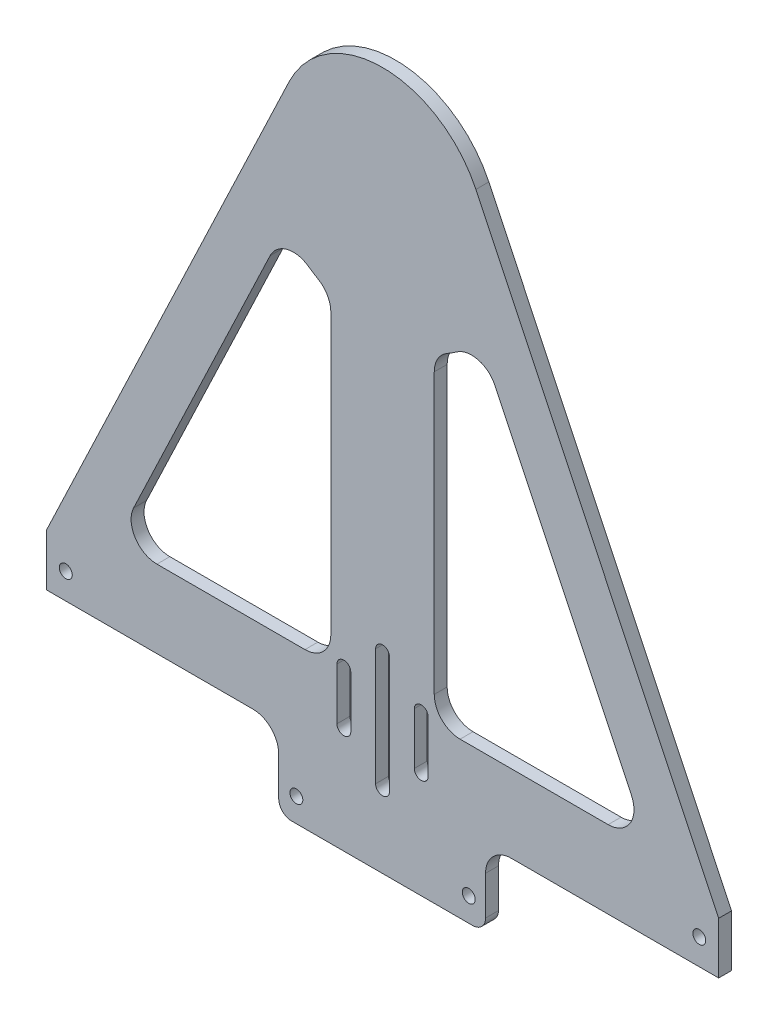
from build123d import *

# Parameters (mm, degrees)
SKETCH5_R           = 1.5875
BOSS_EXTRUDE2_DEPTH = 3.175


with BuildPart() as part:
    # Sketch5 → Boss-Extrude2 (new body)
    with BuildSketch(Plane.XY):
        with BuildLine():
            Line((-82.55, 58.42), (-82.55, 45.72))
            Line((-82.55, 45.72), (-31.848963051, 45.72))
            ThreePointArc((-31.848963051, 45.72), (-27.35883499, 43.860128061), (-25.498963051, 39.37))
            Line((-25.498963051, 39.37), (-25.498963051, 29.845))
            ThreePointArc((-25.498963051, 29.845), (-24.569027081, 27.59993597), (-22.323963051, 26.67))
            Line((-22.323963051, 26.67), (22.126036949, 26.67))
            ThreePointArc((22.126036949, 26.67), (24.37110098, 27.59993597), (25.301036949, 29.845))
            Line((25.301036949, 29.845), (25.301036949, 39.37))
            ThreePointArc((25.301036949, 39.37), (27.160908889, 43.860128061), (31.651036949, 45.72))
            Line((31.651036949, 45.72), (82.55, 45.72))
            Line((82.55, 45.72), (82.55, 58.42))
            Line((82.55, 58.42), (22.933465972, 183.638614313))
            ThreePointArc((22.933465972, 183.638614313), (0, 198.12), (-22.933465972, 183.638614313))
            Line((-22.933465972, 183.638614313), (-82.55, 58.42))
        make_face()
        with Locations((-77.7875, 52.07)):
            Circle(SKETCH5_R, mode=Mode.SUBTRACT)
        with Locations((77.7875, 52.07)):
            Circle(SKETCH5_R, mode=Mode.SUBTRACT)
        with Locations((-21.166666667, 32.503356634)):
            Circle(SKETCH5_R, mode=Mode.SUBTRACT)
        with Locations((21.166666667, 32.503356634)):
            Circle(SKETCH5_R, mode=Mode.SUBTRACT)
        with BuildLine():
            Line((-61.138040857, 73.849653578), (-27.615581335, 144.260253558))
            ThreePointArc((-27.615581335, 144.260253558), (-23.498279642, 147.671514779), (-18.235179035, 146.728833317))
            ThreePointArc((-18.235179035, 146.728833317), (-17.071685329, 145.950239821), (-15.875, 145.22369343))
            ThreePointArc((-15.875, 145.22369343), (-13.550738686, 142.899432116), (-12.7, 139.724432116))
            Line((-12.7, 139.724432116), (-12.7, 71.12))
            ThreePointArc((-12.7, 71.12), (-14.559871939, 66.629871939), (-19.05, 64.77))
            Line((-19.05, 64.77), (-55.404674364, 64.77))
            ThreePointArc((-55.404674364, 64.77), (-60.77383632, 67.729631305), (-61.138040857, 73.849653578))
        make_face(mode=Mode.SUBTRACT)
        with BuildLine():
            Line((61.138040857, 73.849653578), (27.615581335, 144.260253558))
            ThreePointArc((27.615581335, 144.260253558), (23.498279642, 147.671514779), (18.235179035, 146.728833317))
            ThreePointArc((18.235179035, 146.728833317), (17.071685329, 145.950239821), (15.875, 145.22369343))
            ThreePointArc((15.875, 145.22369343), (13.550738686, 142.899432116), (12.7, 139.724432116))
            Line((12.7, 139.724432116), (12.7, 71.12))
            ThreePointArc((12.7, 71.12), (14.559871939, 66.629871939), (19.05, 64.77))
            Line((19.05, 64.77), (55.404674364, 64.77))
            ThreePointArc((55.404674364, 64.77), (60.77383632, 67.729631305), (61.138040857, 73.849653578))
        make_face(mode=Mode.SUBTRACT)
        with BuildLine():
            Line((-11.2, 52.915063076), (-11.2, 65.615063076))
            ThreePointArc((-11.2, 65.615063076), (-9.5, 67.315063076), (-7.8, 65.615063076))
            Line((-7.8, 65.615063076), (-7.8, 52.915063076))
            ThreePointArc((-7.8, 52.915063076), (-9.5, 51.215063076), (-11.2, 52.915063076))
        make_face(mode=Mode.SUBTRACT)
        with BuildLine():
            Line((-1.7, 44.915063076), (-1.7, 73.615063076))
            ThreePointArc((-1.7, 73.615063076), (0, 75.315063076), (1.7, 73.615063076))
            Line((1.7, 73.615063076), (1.7, 44.915063076))
            ThreePointArc((1.7, 44.915063076), (0, 43.215063076), (-1.7, 44.915063076))
        make_face(mode=Mode.SUBTRACT)
        with BuildLine():
            Line((7.8, 52.915063076), (7.8, 65.615063076))
            ThreePointArc((7.8, 65.615063076), (9.5, 67.315063076), (11.2, 65.615063076))
            Line((11.2, 65.615063076), (11.2, 52.915063076))
            ThreePointArc((11.2, 52.915063076), (9.5, 51.215063076), (7.8, 52.915063076))
        make_face(mode=Mode.SUBTRACT)
    extrude(amount=BOSS_EXTRUDE2_DEPTH)


solid = part.part
